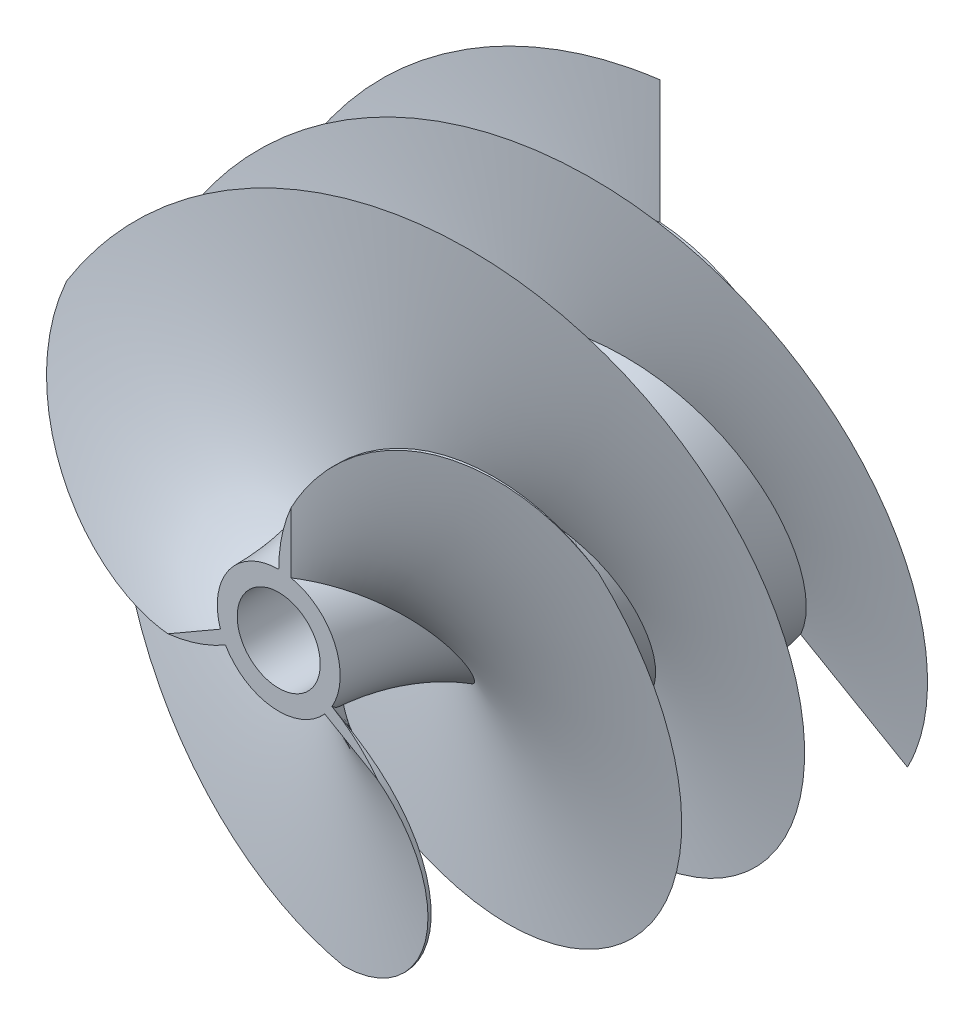
from build123d import *
from build123d.topology import SkipClean

# Parameters (mm, degrees)
SWEEP2_PITCH       = 30
CUT_EXTRUDE1_DEPTH = 10
CIRPATTERN4_COUNT  = 3
SKETCH7_R          = 1.190625
CUT_EXTRUDE2_DEPTH = 5


with BuildPart() as part:
    # Sketch2 → Revolve1 (revolve)
    with BuildSketch(Plane.YZ, mode=Mode.PRIVATE) as revolve1_sk:
        with BuildLine():
            Line((-3.3782, 0), (-3.3782, 30))
            Line((-3.3782, 30), (-5, 30))
            ThreePointArc((-5, 30), (-6.282917549, 22.09430585), (-10, 15))
            ThreePointArc((-10, 15), (-13.717082451, 7.90569415), (-15, 0))
            Line((-15, 0), (-3.3782, 0))
        make_face()
    revolve(revolve1_sk.sketch.rotate(Axis((0, 0, 31.5), (0, 0, -1)), 270), axis=Axis((0, 0, 31.5), (0, 0, -1)))

    # Sweep2: the profile of Sketch4 screwed along a right-hand helix of 1 turns, 22 arcs to a turn; built about Z, then put on its axis
    sweep2_z = Axis((0, 0, 0), (0, 0, 1))
    sweep2_corners = [(25, 1, 0), (3.3782, 1, 0), (3.3782, 0, 0), (18.755002002, 0, 0)]
    with BuildLine(mode=Mode.PRIVATE) as sweep2_profile:
        Line(sweep2_corners[0], sweep2_corners[1])
        Line(sweep2_corners[1], sweep2_corners[2])
        Line(sweep2_corners[2], sweep2_corners[3])
        ThreePointArc((18.755002002, 0, 0), (21.917279662, 0.251582342, 0), (25, 1, 0))
    sweep2_cap = Face(sweep2_profile.wire())
    sweep2_arcs = [((18.755002002, 0, 0), (21.957565078, 0, 0), (25, 1, 0), (1, 0.9874208829065753, 1))]  # start, shoulder, end, weights
    sweep2_turn_angles = [0, 8.181818182, 16.363636364, 24.545454545, 32.727272727, 40.909090909, 49.090909091, 57.272727273, 65.454545455, 73.636363636, 81.818181818, 90, 98.181818182, 106.363636364, 114.545454545, 122.727272727, 130.909090909, 139.090909091, 147.272727273, 155.454545455, 163.636363636, 171.818181818, 180, 188.181818182, 196.363636364, 204.545454545, 212.727272727, 220.909090909, 229.090909091, 237.272727273, 245.454545455, 253.636363636, 261.818181818, 270, 278.181818182, 286.363636364, 294.545454545, 302.727272727, 310.909090909, 319.090909091, 327.272727273, 335.454545455, 343.636363636, 351.818181818, 360]
    sweep2_turn_weights = [1, 0.9898214418809327, 1, 0.9898214418809327, 1, 0.9898214418809327, 1, 0.9898214418809327, 1, 0.9898214418809327, 1, 0.9898214418809327, 1, 0.9898214418809327, 1, 0.9898214418809327, 1, 0.9898214418809327, 1, 0.9898214418809328, 1, 0.9898214418809327, 1, 0.9898214418809327, 1, 0.9898214418809328, 1, 0.9898214418809327, 1, 0.9898214418809328, 1, 0.9898214418809327, 1, 0.9898214418809327, 1, 0.9898214418809327, 1, 0.9898214418809328, 1, 0.9898214418809327, 1, 0.9898214418809327, 1, 0.9898214418809327, 1]
    sweep2_turn_rails = [Edge.make_bspline([Vector(p[0], p[1], 0).rotate(sweep2_z, sweep2_turn_angles[k]) / sweep2_turn_weights[k] + Vector(0, 0, p[2] + SWEEP2_PITCH * sweep2_turn_angles[k] / 360) for k in range(45)], [0, 0, 0, 1, 1, 2, 2, 3, 3, 4, 4, 5, 5, 6, 6, 7, 7, 8, 8, 9, 9, 10, 10, 11, 11, 12, 12, 13, 13, 14, 14, 15, 15, 16, 16, 17, 17, 18, 18, 19, 19, 20, 20, 21, 21, 22, 22, 22], 2, sweep2_turn_weights) for p in sweep2_corners]
    sweep2_turn_sides = [*[Face.make_surface_from_curves(sweep2_turn_rails[p[0]], sweep2_turn_rails[p[1]]) for p in [(0, 1), (1, 2), (2, 3)]], *[Face.make_bezier_surface([[Vector(p[j][0], p[j][1], 0).rotate(sweep2_z, sweep2_turn_angles[2 * i + k]) / sweep2_turn_weights[2 * i + k] + Vector(0, 0, p[j][2] + SWEEP2_PITCH * sweep2_turn_angles[2 * i + k] / 360) for k in range(3)] for j in range(3)], [[p[3][j] * sweep2_turn_weights[2 * i + k] for k in range(3)] for j in range(3)]) for p in sweep2_arcs for i in range(22)]]
    sweep2 = Plane(origin=(0, 0, 30), x_dir=(0, 1, 0), z_dir=(0, 0, -1)) * Solid(Shell([*sweep2_turn_sides, sweep2_cap, sweep2_cap.rotate(sweep2_z, 360).moved(Location((0, 0, SWEEP2_PITCH * 360 / 360)))]))
    add(sweep2)

    # Sketch6 → Cut-Extrude1 (cut)
    with BuildSketch(Plane.XY.offset(30)):
        with BuildLine():
            Line((0, 5), (-29.580398915, 5))
            ThreePointArc((-29.580398915, 5), (-5.714158223, 29.450779205), (25.564222163, 15.699380408))
            Line((25.564222163, 15.699380408), (21.303518469, 13.082817006))
            ThreePointArc((21.303518469, 13.082817006), (7.862599717, 16.392671218), (0, 5))
        make_face()
    extrude(amount=-CUT_EXTRUDE1_DEPTH, mode=Mode.SUBTRACT)


with BuildPart() as cirpattern4_1:
    # CirPattern4: pattern copy
    add(part.part.rotate(Axis((0, 0, 31.5), (0, 0, -1)), 1 * 360 / CIRPATTERN4_COUNT))


with BuildPart() as cirpattern4_2:
    # CirPattern4: pattern copy
    add(part.part.rotate(Axis((0, 0, 31.5), (0, 0, -1)), 2 * 360 / CIRPATTERN4_COUNT))


with BuildPart() as part_1:
    with SkipClean():  # the faces are left unmerged after this step: merging them gives an invalid solid
        add(part.part)

        add(cirpattern4_1.part)  # Revolve3 merges CirPattern4_1

        add(cirpattern4_2.part)  # Revolve3 merges CirPattern4_2
        # Sketch2<3> → Revolve3 (revolve)
        with BuildSketch(Plane.YZ):
            with BuildLine():
                Line((-3.3782, 0), (-3.3782, 30))
                Line((-3.3782, 30), (-5, 30))
                ThreePointArc((-5, 30), (-6.282917549, 22.09430585), (-10, 15))
                ThreePointArc((-10, 15), (-13.717082451, 7.90569415), (-15, 0))
                Line((-15, 0), (-3.3782, 0))
            make_face()
        revolve(axis=Axis((0, 0, 31.5), (0, 0, -1)))

    # Sketch7 → Cut-Extrude2 (cut)
    with SkipClean():  # the faces are left unmerged after this step: merging them gives an invalid solid
        with BuildSketch(Plane(origin=(0, 0, 0), x_dir=(1, 0, 0), z_dir=(0, 0, -1))):
            with Locations(Location((0, 7.5, 0), (0, 0, 180))):
                Circle(SKETCH7_R)
            with Locations(Location((7.5, 0, 0), (0, 0, 180))):
                Circle(SKETCH7_R)
            with Locations(Location((0, -7.5, 0), (0, 0, 180))):
                Circle(SKETCH7_R)
            with Locations(Location((-7.5, 0, 0), (0, 0, 180))):
                Circle(SKETCH7_R)
        extrude(amount=-CUT_EXTRUDE2_DEPTH, mode=Mode.SUBTRACT)


solid = part_1.part
